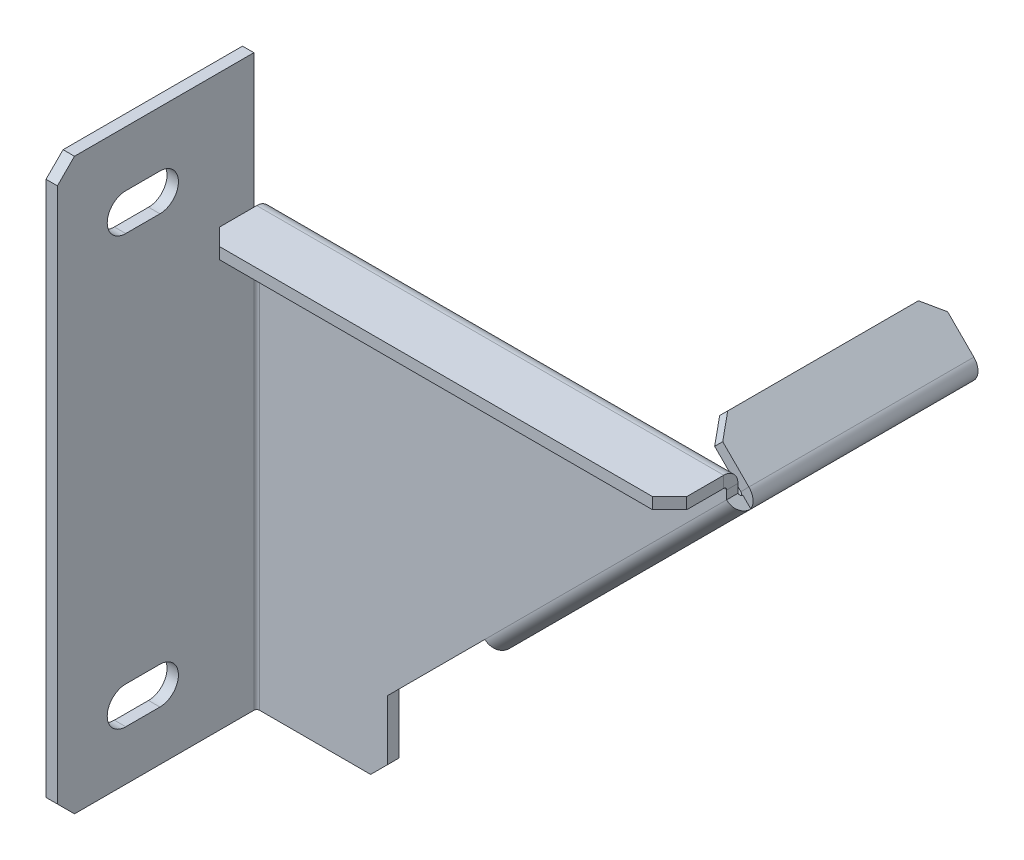
from build123d import *

# Parameters (mm, degrees)
SKETCH_1_W                       = 2
SKETCH_1_H                       = 75
SM_BASE_FLANGE_1_DEPTH           = 35
SM_EDGE_FLANGE_1_STRIP_W         = 9
SM_EDGE_FLANGE_1_STRIP_H         = 2
SM_EDGE_FLANGE_1_STRIP_CUT_DEPTH = 75
SM_EDGE_FLANGE_1_DEPTH           = 75
CUT_EXTRUDE_1_DEPTH              = 2
SM_EDGE_FLANGE_2_DEPTH           = 60
SM_EDGE_FLANGE_3_STRIP_W         = 9
SM_EDGE_FLANGE_3_STRIP_H         = 2
SM_EDGE_FLANGE_3_STRIP_CUT_DEPTH = 39.5
SM_EDGE_FLANGE_3_DEPTH           = 39.5
SM_EDGE_FLANGE_4_STRIP_W         = 9
SM_EDGE_FLANGE_4_STRIP_H         = 2
SM_EDGE_FLANGE_4_STRIP_CUT_DEPTH = 82
SM_EDGE_FLANGE_4_DEPTH           = 82
SM_EDGE_FLANGE_5_DEPTH           = 38
SKETCH_18_R                      = 4.35
EXTRUDE_1_DEPTH                  = 2
HOLE_WIZARD_M5_1_D               = 4.2
HOLE_WIZARD_M5_1_DEPTH           = 33.751449569
PATTERN_LINEAR_1_COUNT           = 2
PATTERN_LINEAR_1_PITCH           = 20
PATTERN_LINEAR_1_COUNT_DIR2      = 2
PATTERN_LINEAR_1_PITCH_DIR2      = 35
SKETCH_26_W                      = 34.5
SKETCH_26_H                      = 25
SM_BASE_FLANGE_1_2_DEPTH         = 2
CUT_EXTRUDE_2_DEPTH              = 2
CHAMFER_1_SIZE                   = 3


# Sheet-metal steps are written as plain solids
with BuildPart() as part:
    # Sketch 1 → Sm Base Flange 1 (new body)
    with BuildSketch(Plane.XY):
        with Locations((1, 0)):
            Rectangle(SKETCH_1_W, SKETCH_1_H)
    extrude(amount=SM_BASE_FLANGE_1_DEPTH)

    # 边线-法兰1 strip (across the edge) → 边线-法兰1 strip cut (cut)
    with BuildSketch(Plane(origin=(2, -37.5, 0), x_dir=(0, 0, 1), z_dir=(0, 1, 0))):
        with Locations((-4, -1)):
            Rectangle(SM_EDGE_FLANGE_1_STRIP_W, SM_EDGE_FLANGE_1_STRIP_H)
    extrude(amount=SM_EDGE_FLANGE_1_STRIP_CUT_DEPTH, mode=Mode.SUBTRACT)

    # 边线-法兰1 section (across the edge) → 边线-法兰1 (add)
    with BuildSketch(Plane(origin=(2, -37.5, 0), x_dir=(0, 0, 1), z_dir=(0, 1, 0))):
        with BuildLine():
            Line((-2, 0.5), (-2, 84))
            Line((-2, 84), (0, 84))
            Line((0, 84), (0, 0.5))
            ThreePointArc((0, 0.5), (0.146446609, 0.146446609), (0.5, 0))
            Line((0.5, 0), (0.5, -2))
            ThreePointArc((0.5, -2), (-1.267766953, -1.267766953), (-2, 0.5))
        make_face()
    extrude(amount=SM_EDGE_FLANGE_1_DEPTH)

    # 草图6 → 切除-拉伸1 (cut)
    with BuildSketch(Plane(origin=(0, 0, -2), x_dir=(-1, 0, 0), z_dir=(0, 0, -1))):
        Polygon((-84.5, 35.5), (-25, -24), (-25, -37.5), (-86, -37.5), (-86, 37.5), (-84.5, 37.5), align=None)
    extrude(amount=-CUT_EXTRUDE_1_DEPTH, mode=Mode.SUBTRACT)

    # 边线-法兰2 section (across the edge) → 边线-法兰2 (add)
    with BuildSketch(Plane(origin=(84.853553391, 35.146446609, -2), x_dir=(-0.7071067811865437, 0.7071067811865513, -1.0226318000689522e-15), z_dir=(-0.7071067811865513, -0.7071067811865437, 2.468731249046521e-15))):
        with BuildLine():
            Line((-2, 0.5), (-2, 40))
            Line((-2, 40), (0, 40))
            Line((0, 40), (0, 0.5))
            ThreePointArc((0, 0.5), (0.146446609, 0.146446609), (0.5, 0))
            Line((0.5, 0), (0.5, -2))
            ThreePointArc((0.5, -2), (-1.267766953, -1.267766953), (-2, 0.5))
        make_face()
    extrude(amount=SM_EDGE_FLANGE_2_DEPTH)

    # 边线-法兰3 strip (across the edge) → 边线-法兰3 strip cut (cut)
    with BuildSketch(Plane(origin=(84.853553391, 35.146446609, -2.5), x_dir=(-0.7071067811865538, -0.7071067811865412, 2.111674983989249e-15), z_dir=(0, 0, -1))):
        with Locations((-4, -1)):
            Rectangle(SM_EDGE_FLANGE_3_STRIP_W, SM_EDGE_FLANGE_3_STRIP_H)
    extrude(amount=SM_EDGE_FLANGE_3_STRIP_CUT_DEPTH, mode=Mode.SUBTRACT)

    # 边线-法兰3 section (across the edge) → 边线-法兰3 (add)
    with BuildSketch(Plane(origin=(84.853553391, 35.146446609, -2.5), x_dir=(-0.7071067811865538, -0.7071067811865412, 2.111674983989249e-15), z_dir=(0, 0, -1))):
        with BuildLine():
            Line((-2, 0.5), (-2, 10))
            Line((-2, 10), (0, 10))
            Line((0, 10), (0, 0.5))
            ThreePointArc((0, 0.5), (0.146446609, 0.146446609), (0.5, 0))
            Line((0.5, 0), (0.5, -2))
            ThreePointArc((0.5, -2), (-1.267766953, -1.267766953), (-2, 0.5))
        make_face()
    extrude(amount=SM_EDGE_FLANGE_3_DEPTH)

    # 边线-法兰4 strip (across the edge) → 边线-法兰4 strip cut (cut)
    with BuildSketch(Plane(origin=(84.5, 37.5, 0), x_dir=(0, -1, 0), z_dir=(-1, 0, 0))):
        with Locations((-4, -1)):
            Rectangle(SM_EDGE_FLANGE_4_STRIP_W, SM_EDGE_FLANGE_4_STRIP_H)
    extrude(amount=SM_EDGE_FLANGE_4_STRIP_CUT_DEPTH, mode=Mode.SUBTRACT)

    # 边线-法兰4 section (across the edge) → 边线-法兰4 (add)
    with BuildSketch(Plane(origin=(84.5, 37.5, 0), x_dir=(0, -1, 0), z_dir=(-1, 0, 0))):
        with BuildLine():
            Line((-2, 0.5), (-2, 10))
            Line((-2, 10), (0, 10))
            Line((0, 10), (0, 0.5))
            ThreePointArc((0, 0.5), (0.146446609, 0.146446609), (0.5, 0))
            Line((0.5, 0), (0.5, -2))
            ThreePointArc((0.5, -2), (-1.267766953, -1.267766953), (-2, 0.5))
        make_face()
    extrude(amount=SM_EDGE_FLANGE_4_DEPTH)

    # 边线-法兰5 section (across the edge) → 边线-法兰5 (add)
    with BuildSketch(Plane(origin=(42.073593129, -7.633513652, -42), x_dir=(0.7071067811865489, 0.7071067811865461, -2.23589115951803e-15), z_dir=(0, 0, 1))):
        with BuildLine():
            Line((-2, 0.5), (-2, 10))
            Line((-2, 10), (0, 10))
            Line((0, 10), (0, 0.5))
            ThreePointArc((0, 0.5), (0.146446609, 0.146446609), (0.5, 0))
            Line((0.5, 0), (0.5, -2))
            ThreePointArc((0.5, -2), (-1.267766953, -1.267766953), (-2, 0.5))
        make_face()
    extrude(amount=SM_EDGE_FLANGE_5_DEPTH)

    # 草图18 → 凸台-拉伸1 (add)
    with BuildSketch(Plane(origin=(24.853553391, -24.853553391, 0), x_dir=(0, 0, 1), z_dir=(-0.7071067811865436, 0.7071067811865515, -1.027306589177874e-15))):
        with Locations(Location((-33, 74.352813742, 0), (0, 0, 270))):
            Circle(SKETCH_18_R)
    extrude_1 = extrude(amount=EXTRUDE_1_DEPTH)

    # M5 螺纹孔1
    with Locations(Plane(origin=(23.439339828, -23.439339828, 0), x_dir=(-0.7071067811865515, -0.7071067811865436, 1.0273065891778625e-15), z_dir=(-0.7071067811865436, 0.7071067811865515, -1.027306589177874e-15))):
        with Locations((-74.352813742, -33)):
            hole_wizard_m5_1 = Hole(HOLE_WIZARD_M5_1_D / 2, depth=HOLE_WIZARD_M5_1_DEPTH)

    # 阵列(线性)1: 凸台-拉伸1, Hole Wizard M5 _1 2 × 2
    with Locations(*[Vector(0, 0, 1) * (i * PATTERN_LINEAR_1_PITCH) + Vector(-0.7071067811865475, -0.7071067811865477, 1.982541115402065e-15) * (j * PATTERN_LINEAR_1_PITCH_DIR2) for i in range(PATTERN_LINEAR_1_COUNT) for j in range(PATTERN_LINEAR_1_COUNT_DIR2) if (i, j) != (0, 0)]):
        add(extrude_1)
        add(hole_wizard_m5_1, mode=Mode.SUBTRACT)

    # 草图26 → Sm Base Flange 1 2 (add)
    with BuildSketch(Plane.ZY):
        with Locations((17.75, 50)):
            Rectangle(SKETCH_26_W, SKETCH_26_H)
    extrude(amount=-SM_BASE_FLANGE_1_2_DEPTH)

    # 草图16 → 切除-拉伸2 (cut)
    with BuildSketch(Plane.ZY):
        with BuildLine():
            Line((17, -22.25), (23, -22.25))
            ThreePointArc((23, -22.25), (26.25, -25.5), (23, -28.75))
            Line((23, -28.75), (17, -28.75))
            ThreePointArc((17, -28.75), (13.75, -25.5), (17, -22.25))
        make_face()
        with BuildLine():
            Line((17, 52.75), (23, 52.75))
            ThreePointArc((23, 52.75), (26.25, 49.5), (23, 46.25))
            Line((23, 46.25), (17, 46.25))
            ThreePointArc((17, 46.25), (13.75, 49.5), (17, 52.75))
        make_face()
    extrude(amount=-CUT_EXTRUDE_2_DEPTH, mode=Mode.SUBTRACT)

    # 倒角1
    chamfer_1_edges = [part.edges().sort_by_distance(p)[0] for p in [
        (78.48959236, 42.924621202, -2.5),
        (78.48959236, 42.924621202, -42),
        (84.5, 38.5, 10),
        (2.5, 38.5, 10),
        (34.295418536, -1.269552622, -42),
        (34.295418536, -1.269552622, -4),
        (1, 62.5, 35),
        (25, -37.5, -1),
        (1, -37.5, 35),
    ]]
    chamfer(chamfer_1_edges, length=CHAMFER_1_SIZE)


solid = part.part
